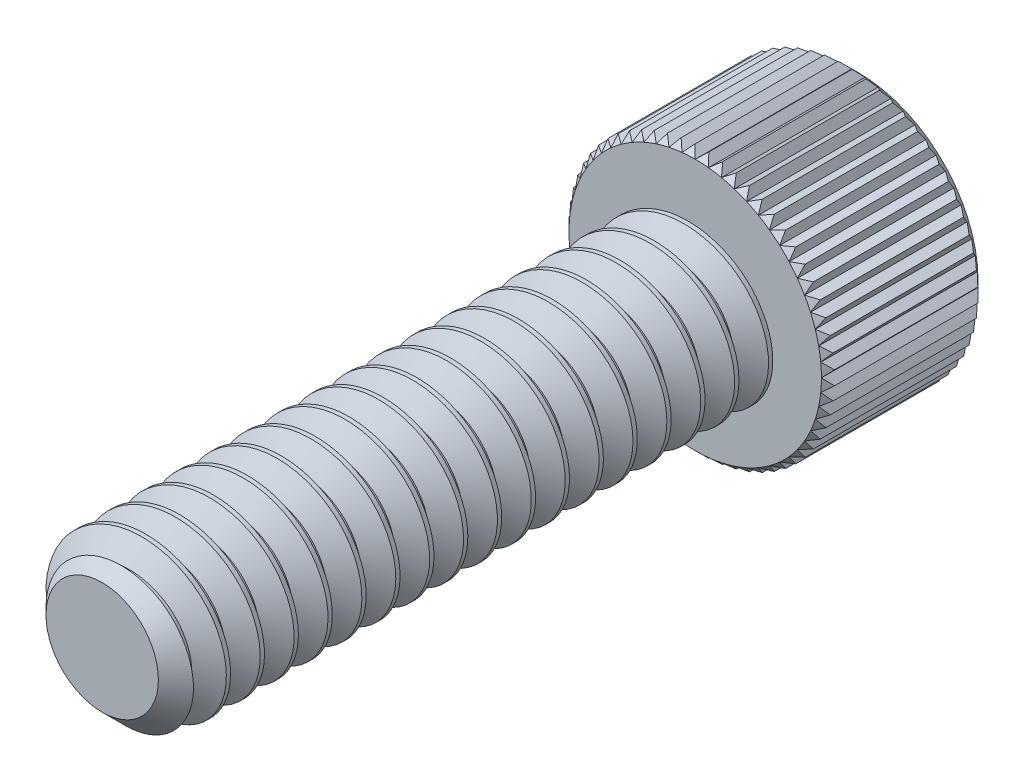
from build123d import *
from build123d.topology import SkipClean

# Parameters (mm, degrees)
SKETCH1_R          = 1.0922
EXTRUDE1_DEPTH     = 7.9375
CHAMFER3_SIZE      = 0.340178571
CUT_SWEEP1_PITCH   = 0.453571429
SKETCH6_R          = 1.778
EXTRUDE2_DEPTH     = 2.1844
CUT_EXTRUDE1_DEPTH = 1.48828125
CHAMFER1_SIZE      = 0.1778
CHAMFER2_SIZE      = 0.0889
CUT_EXTRUDE3_DEPTH = 9.326252208
CIRPATTERN1_COUNT  = 60


with BuildPart() as part:
    # Sketch1 → Extrude1 (new body)
    with BuildSketch(Plane.XY):
        Circle(SKETCH1_R)
    extrude(amount=-EXTRUDE1_DEPTH)

    # Chamfer3
    chamfer3_edges = [part.edges().sort_by_distance(p)[0] for p in [
        (-1.0922, 0, 0),
    ]]
    chamfer(chamfer3_edges, length=CHAMFER3_SIZE)

    # Cut-Sweep1: arcs per turn and ends read off the stored shape
    # Cut-Sweep1: the profile of Sketch3 profile screwed along a right-hand helix through 19 turns, 6 arcs to a turn; built about Z, then put on its axis
    cut_sweep1_z = Axis((0, 0, 0), (0, 0, 1))
    cut_sweep1_corners = [(1.0925, 0, -0.397048205), (0.797596715, 0, -0.226785714), (0.797596715, 0, -0.170089286), (1.0925, 0, 0.000173205)]
    with BuildLine(mode=Mode.PRIVATE) as cut_sweep1_profile:
        Line(cut_sweep1_corners[0], cut_sweep1_corners[1])
        Line(cut_sweep1_corners[1], cut_sweep1_corners[2])
        Line(cut_sweep1_corners[2], cut_sweep1_corners[3])
        Line(cut_sweep1_corners[3], cut_sweep1_corners[0])
    cut_sweep1_cap = Face(cut_sweep1_profile.wire())
    cut_sweep1_turn_angles = [0, 30, 60, 90, 120, 150, 180, 210, 240, 270, 300, 330, 360]
    cut_sweep1_turn_weights = [1, 0.8660254037844387, 1, 0.8660254037844387, 1, 0.8660254037844387, 1, 0.8660254037844387, 1, 0.8660254037844387, 1, 0.8660254037844387, 1]
    cut_sweep1_turn_rails = [Edge.make_bspline([Vector(p[0], p[1], 0).rotate(cut_sweep1_z, cut_sweep1_turn_angles[k]) / cut_sweep1_turn_weights[k] + Vector(0, 0, p[2] + CUT_SWEEP1_PITCH * cut_sweep1_turn_angles[k] / 360) for k in range(13)], [0, 0, 0, 1, 1, 2, 2, 3, 3, 4, 4, 5, 5, 6, 6, 6], 2, cut_sweep1_turn_weights) for p in cut_sweep1_corners]
    cut_sweep1_turn_sides = [Face.make_surface_from_curves(cut_sweep1_turn_rails[p[0]], cut_sweep1_turn_rails[p[1]]) for p in [(0, 1), (1, 2), (2, 3), (3, 0)]]
    cut_sweep1 = Plane(origin=(0, 0, 0), x_dir=(0, 1, 0), z_dir=(0, 0, -1)) * Solid(Shell([*[p.moved(Location((0, 0, CUT_SWEEP1_PITCH * i))) for i in range(19) for p in cut_sweep1_turn_sides], cut_sweep1_cap, cut_sweep1_cap.rotate(cut_sweep1_z, 6840).moved(Location((0, 0, CUT_SWEEP1_PITCH * 6840 / 360)))]))
    add(cut_sweep1, mode=Mode.SUBTRACT)

    # Sketch6 → Extrude2 (add)
    with BuildSketch(Plane(origin=(0, 0, -7.9375), x_dir=(-1, 0, 0), z_dir=(0, 0, -1))):
        Circle(SKETCH6_R)
    extrude(amount=EXTRUDE2_DEPTH)

    # Sketch7 → Cut-Extrude1 (cut)
    with BuildSketch(Plane(origin=(0, 0, -10.1219), x_dir=(-1, 0, 0), z_dir=(0, 0, -1))):
        Polygon((0, 1.14567944), (-0.9921875, 0.57283972), (-0.9921875, -0.57283972), (0, -1.14567944), (0.9921875, -0.57283972), (0.9921875, 0.57283972), align=None)
    extrude(amount=-CUT_EXTRUDE1_DEPTH, mode=Mode.SUBTRACT)

    # Cut-Extrude2 cone 1 section (through the dimple's axis) → Cut-Extrude2 (revolve, cut)
    with BuildSketch(Plane(origin=(0, 0, -10.1219), x_dir=(0, 1, 0), z_dir=(1, 0, 0))):
        Polygon((0, 0), (1.14567944, 0), (0, 1.14567944), align=None)
    revolve(axis=Axis((0, 0, -10.1219), (0, 0, 1)), mode=Mode.SUBTRACT)

    # Chamfer1
    chamfer1_edges = [part.edges().sort_by_distance(p)[0] for p in [
        (1.778, 0, -10.1219),
    ]]
    chamfer(chamfer1_edges, length=CHAMFER1_SIZE)

    # Chamfer2
    chamfer2_edges = [part.edges().sort_by_distance(p)[0] for p in [
        (1.778, 0, -7.9375),
    ]]
    chamfer(chamfer2_edges, length=CHAMFER2_SIZE)

    # Sketch10 → Cut-Extrude3 (cut, through all)
    with SkipClean():  # the faces are left unmerged after this step: merging them gives an invalid solid
        with BuildSketch(Plane.XY.offset(-7.9375)):
            Polygon((-0.191351471, 1.8669), (0, 1.6891), (0.191351471, 1.8669), align=None)
        cut_extrude3 = extrude(amount=-CUT_EXTRUDE3_DEPTH, mode=Mode.SUBTRACT)

    # CirPattern1: Cut-Extrude3 ×60 about axis
    cirpattern1_axis = Axis((0, 0, 0), (0, 0, 1))
    for i in range(1, CIRPATTERN1_COUNT):
        add(cut_extrude3.rotate(cirpattern1_axis, i * 360 / CIRPATTERN1_COUNT), mode=Mode.SUBTRACT)


solid = part.part
